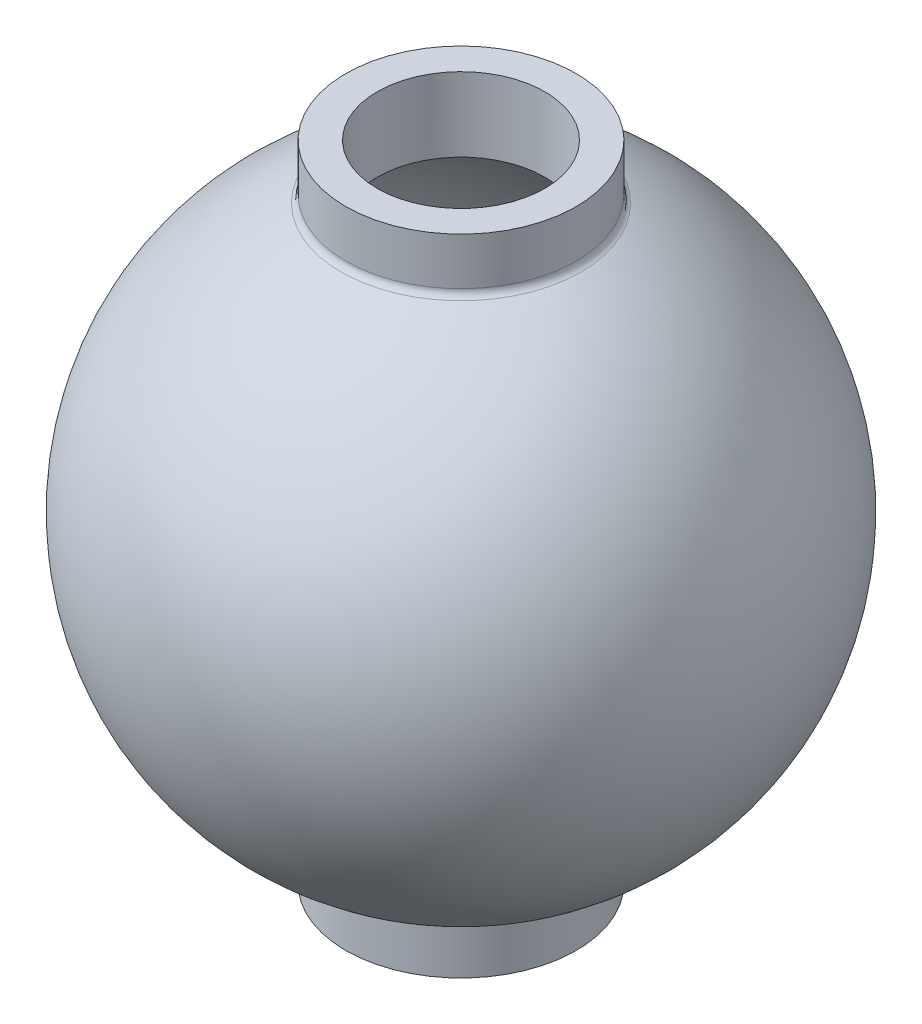
from build123d import *

# Parameters (mm, degrees)
CUT_EXTRUDE1_START  = -1000
SKETCH2_R           = 320
CUT_EXTRUDE1_DEPTH  = 1000
FILLET1_R           = 30
SKETCH4_R           = 300
BOSS_EXTRUDE1_DEPTH = 160


with BuildPart() as part:
    # Sketch1 → Revolve1 (revolve)
    with BuildSketch(Plane.XY):
        with BuildLine():
            ThreePointArc((320, 1073.3126292), (161.693932008, 1108.266697303), (0, 1120))
            Line((0, 1120), (0, 1000))
            ThreePointArc((0, 1000), (1000, 0), (0, -1000))
            Line((0, -1000), (0, -1120))
            ThreePointArc((0, -1120), (161.693932008, -1108.266697303), (320, -1073.3126292))
            Line((320, -1073.3126292), (320, -1229.951455167))
            Line((320, -1229.951455167), (440, -1229.951455167))
            Line((440, -1229.951455167), (440, -1029.951455167))
            ThreePointArc((440, -1029.951455167), (1120, 0), (440, 1029.951455167))
            Line((440, 1029.951455167), (440, 1229.951455167))
            Line((440, 1229.951455167), (320, 1229.951455167))
            Line((320, 1229.951455167), (320, 1073.3126292))
        make_face()
    revolve(axis=Axis((0, 1478.863179405, 0), (0, -1, 0)))

    # Sketch2 → Cut-Extrude1 (cut)
    with BuildSketch(Plane(origin=(0, 1229.951455167, 0), x_dir=(1, 0, 0), z_dir=(0, 1, 0)).offset(CUT_EXTRUDE1_START)):
        Circle(SKETCH2_R)
    extrude(amount=CUT_EXTRUDE1_DEPTH, mode=Mode.SUBTRACT)

    # Fillet1
    fillet1_edges = [part.edges().sort_by_distance(p)[0] for p in [
        (-440, 1029.951455167, 0),
        (-440, -1029.951455167, 0),
    ]]
    fillet(fillet1_edges, radius=FILLET1_R)

    # Sketch4 → Boss-Extrude1 (add)
    with BuildSketch(Plane.XZ.offset(1229.951455167)):
        Circle(SKETCH4_R)
    extrude(amount=-BOSS_EXTRUDE1_DEPTH)


solid = part.part
